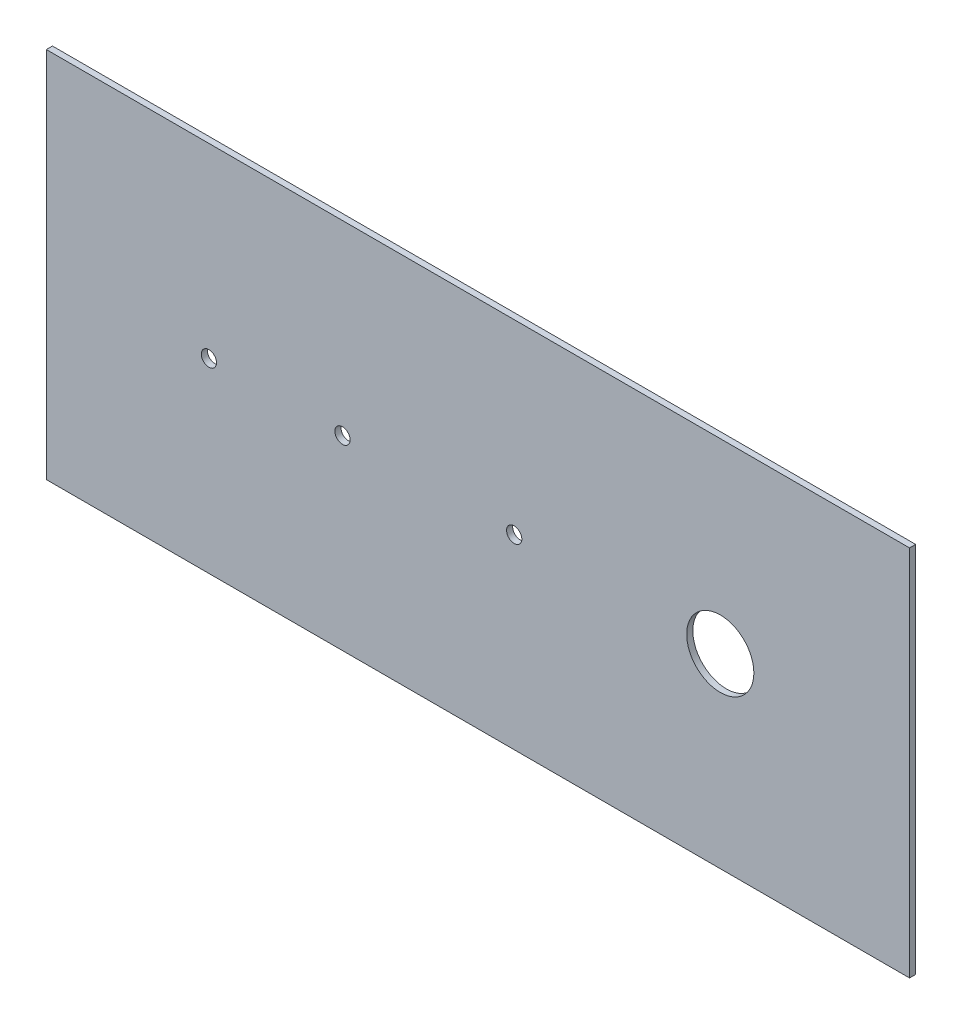
from build123d import *

# Parameters (mm, degrees)
SKETCH_1_W      = 282.75
SKETCH_1_H      = 122
SKETCH_1_R      = 11
SKETCH_1_R_2    = 2.5
EXTRUDE_1_DEPTH = 2


with BuildPart() as part:
    # Эскиз1 → Бобышка-Вытянуть1 (new body)
    with BuildSketch(Plane.XY):
        with Locations((141.375, 61)):
            Rectangle(SKETCH_1_W, SKETCH_1_H)
        with Locations((220.75, 61)):
            Circle(SKETCH_1_R, mode=Mode.SUBTRACT)
        with Locations((153.25, 61)):
            Circle(SKETCH_1_R_2, mode=Mode.SUBTRACT)
        with Locations((97, 61)):
            Circle(SKETCH_1_R_2, mode=Mode.SUBTRACT)
        with Locations((53.25, 61)):
            Circle(SKETCH_1_R_2, mode=Mode.SUBTRACT)
    extrude(amount=EXTRUDE_1_DEPTH)


solid = part.part
